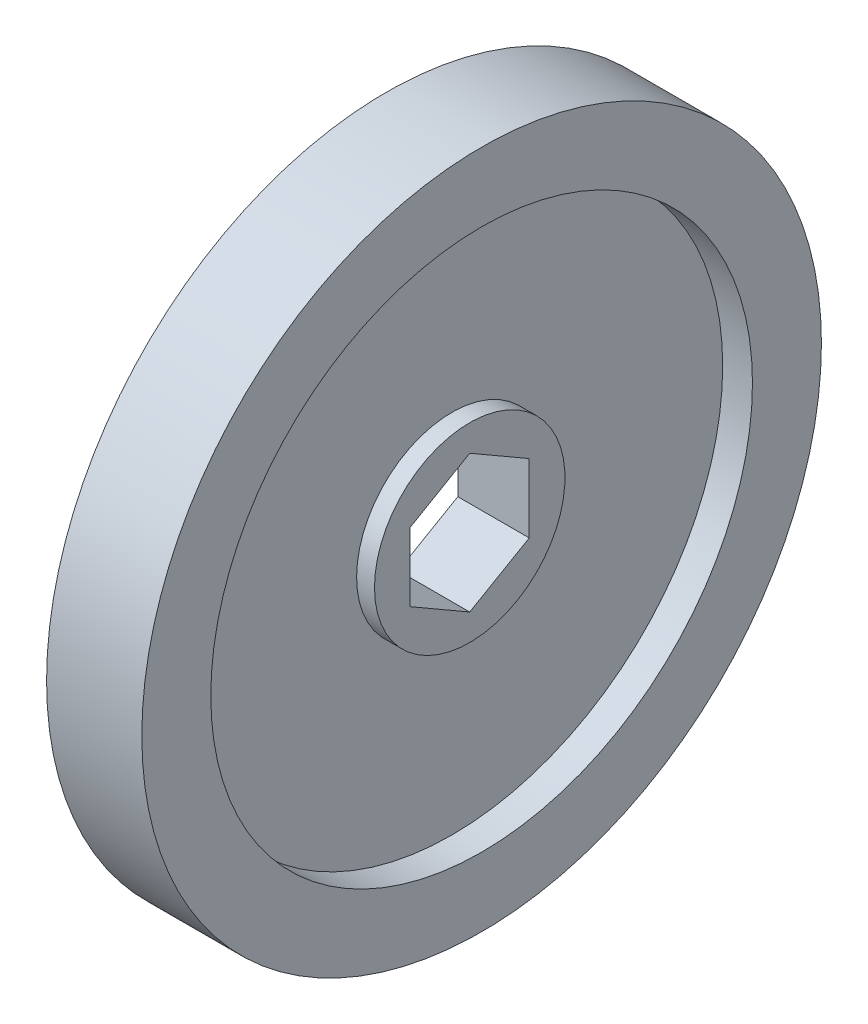
from build123d import *

# Parameters (mm, degrees)
ENL_V_MAT_EXTRU_1_DEPTH = 53.030347875


with BuildPart() as part:
    # Esquisse1 → Révolution1 (revolve)
    with BuildSketch(Plane.XY):
        Polygon((-5.08, 36.25), (5.08, 36.25), (5.08, 28.8925), (1.905, 28.8925), (1.905, 10.16), (3.81, 10.16), (3.81, 0), (-3.81, 0), (-3.81, 10.16), (-1.905, 10.16), (-1.905, 28.8925), (-5.08, 28.8925), align=None)
    revolve(axis=Axis((-12.56603466, 0, 0), (1, 0, 0)))

    # Esquisse2 → Enlèv. mat.-Extru.1 (cut, through all)
    with BuildSketch(Plane(origin=(3.81, 0, 0), x_dir=(0, 0, -1), z_dir=(1, 0, 0))):
        Polygon((0, 7.332348419), (-6.35, 3.666174209), (-6.35, -3.666174209), (0, -7.332348419), (6.35, -3.666174209), (6.35, 3.666174209), align=None)
    extrude(amount=-ENL_V_MAT_EXTRU_1_DEPTH, mode=Mode.SUBTRACT)


solid = part.part
